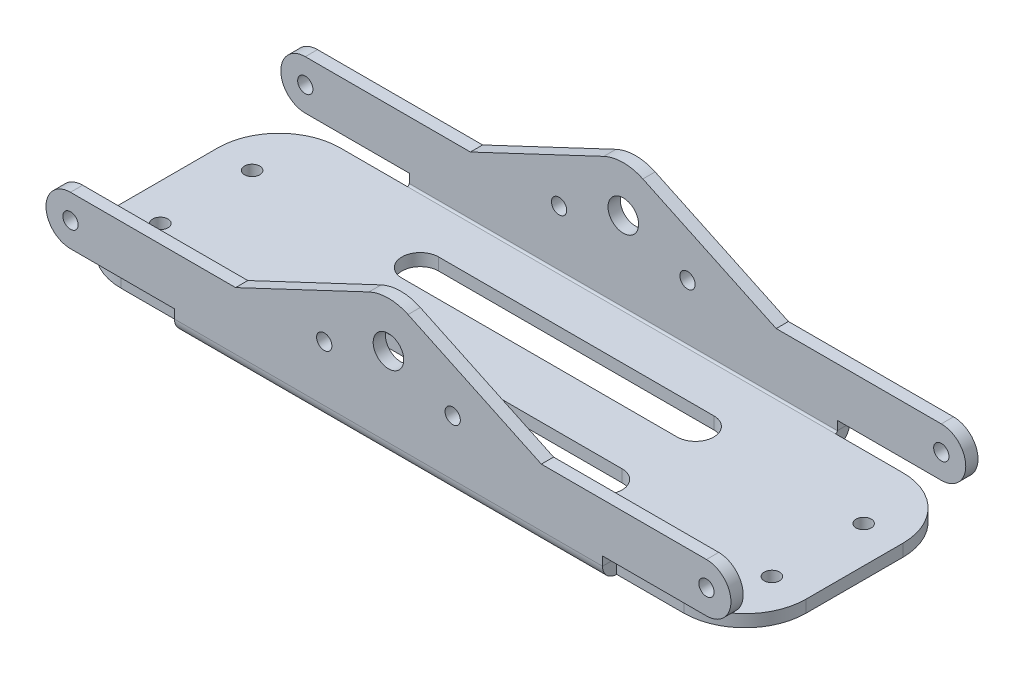
from build123d import *

# Parameters (mm, degrees)
BRIDA_BASE1_DEPTH               = 2
PLIEGUE_START                   = -56
PLIEGUE_CROQUIZADO2_DEPTH       = 112
PLIEGUE_CROQUIZADO2_2_OUTLINE_W = 19
PLIEGUE_CROQUIZADO2_2_OUTLINE_H = 2
PLIEGUE_CROQUIZADO2_2_DEPTH     = 112
PLIEGUE_START_2                 = -35
PLIEGUE_CROQUIZADO2_3_DEPTH     = 70
CROQUIS10_R                     = 1.25
CROQUIS10_R_2                   = 2.5
CORTAR_EXTRUIR2_DEPTH           = 73.104459651
CROQUIS11_R                     = 1.25
CORTAR_EXTRUIR3_DEPTH           = 10
REDONDEO1_R                     = 10


# Read off the part's stored shape, not the designer's step: Pliegue croquizado2
# Sheet-metal steps are written as plain solids
with BuildPart() as part:
    # Croquis base → Brida base1 (new body)
    with BuildSketch(Plane(origin=(0, 0, 0), x_dir=(1, 0, 0), z_dir=(0, 1, 0))):
        Polygon((56, 17.9), (56, -17.9), (35, -17.9), (35, -21.4), (56, -21.4), (56, -40.4), (-56, -40.4), (-56, -21.4), (-35, -21.4), (-35, -17.9), (-56, -17.9), (-56, 17.9), (-35, 17.9), (-35, 21.4), (-56, 21.4), (-56, 40.4), (56, 40.4), (56, 21.4), (35, 21.4), (35, 17.9), align=None)
    extrude(amount=-BRIDA_BASE1_DEPTH)

    # Pliegue croquizado2 outline → Pliegue croquizado2 (cut)
    with BuildSketch(Plane.YZ.offset(PLIEGUE_START)):
        with BuildLine():
            ThreePointArc((0, -20.18035085), (-1.429161647, -19.416575089), (-2, -17.9))
            Line((-2, -17.9), (-2, -40.4))
            Line((-2, -40.4), (0, -40.4))
            Line((0, -40.4), (0, -20.18035085))
        make_face()
        with BuildLine():
            ThreePointArc((-2, 17.9), (-1.429161647, 19.416575089), (0, 20.18035085))
            Line((0, 20.18035085), (0, 40.4))
            Line((0, 40.4), (-2, 40.4))
            Line((-2, 40.4), (-2, 17.9))
        make_face()
    extrude(amount=PLIEGUE_CROQUIZADO2_DEPTH, mode=Mode.SUBTRACT)



with BuildPart() as body_2:
    # Pliegue croquizado2 2 outline → Pliegue croquizado2 2 (new body)
    with BuildSketch(Plane.YZ.offset(PLIEGUE_START)):
        with Locations((11.257964775, -19.2)):
            Rectangle(PLIEGUE_CROQUIZADO2_2_OUTLINE_W, PLIEGUE_CROQUIZADO2_2_OUTLINE_H)
        with Locations((11.257964775, 19.2)):
            Rectangle(PLIEGUE_CROQUIZADO2_2_OUTLINE_W, PLIEGUE_CROQUIZADO2_2_OUTLINE_H)
    extrude(amount=PLIEGUE_CROQUIZADO2_2_DEPTH)


with BuildPart() as part_1:
    add(part.part)

    add(body_2.part)  # Pliegue croquizado2 3 merges body 2
    # Pliegue croquizado2 3 outline → Pliegue croquizado2 3 (add)
    with BuildSketch(Plane.YZ.offset(PLIEGUE_START_2)):
        with BuildLine():
            Line((0, -17.9), (0, -20.18035085))
            ThreePointArc((0, -20.18035085), (0.149678603, -20.195082456), (0.3, -20.2))
            Line((0.3, -20.2), (1.757964775, -20.2))
            Line((1.757964775, -20.2), (1.757964775, -18.2))
            Line((1.757964775, -18.2), (0.3, -18.2))
            ThreePointArc((0.3, -18.2), (0.087867966, -18.112132034), (0, -17.9))
        make_face()
        with BuildLine():
            ThreePointArc((0.3, 20.2), (0.149678603, 20.195082456), (0, 20.18035085))
            Line((0, 20.18035085), (0, 17.9))
            ThreePointArc((0, 17.9), (0.087867966, 18.112132034), (0.3, 18.2))
            Line((0.3, 18.2), (1.757964775, 18.2))
            Line((1.757964775, 18.2), (1.757964775, 20.2))
            Line((1.757964775, 20.2), (0.3, 20.2))
        make_face()
    extrude(amount=PLIEGUE_CROQUIZADO2_3_DEPTH)

    # Croquis10 → Cortar-Extruir2 (cut, through all)
    with BuildSketch(Plane.XY.offset(20.2)):
        with BuildLine():
            ThreePointArc((-56, 5.757964775), (-54.828427125, 8.5863919), (-52, 9.757964775))
            Line((-52, 9.757964775), (-25, 9.757964775))
            Line((-25, 9.757964775), (-3.19965236, 20.041195921))
            ThreePointArc((-3.19965236, 20.041195921), (-1.639476503, 20.576579179), (0, 20.757964775))
            Line((0, 20.757964775), (-56, 20.757964775))
            Line((-56, 20.757964775), (-56, 5.757964775))
        make_face()
        with BuildLine():
            ThreePointArc((-52, 1.757964775), (-54.828427125, 2.92953765), (-56, 5.757964775))
            Line((-56, 5.757964775), (-56, 1.757964775))
            Line((-56, 1.757964775), (-52, 1.757964775))
        make_face()
        with BuildLine():
            Line((56, 20.757964775), (0, 20.757964775))
            ThreePointArc((0, 20.757964775), (1.639476503, 20.576579179), (3.19965236, 20.041195921))
            Line((3.19965236, 20.041195921), (25, 9.757964775))
            Line((25, 9.757964775), (52, 9.757964775))
            ThreePointArc((52, 9.757964775), (54.828427125, 8.5863919), (56, 5.757964775))
            Line((56, 5.757964775), (56, 20.757964775))
        make_face()
        with BuildLine():
            Line((56, 1.757964775), (56, 5.757964775))
            ThreePointArc((56, 5.757964775), (54.828427125, 2.92953765), (52, 1.757964775))
            Line((52, 1.757964775), (56, 1.757964775))
        make_face()
        with Locations((52, 5.757964775)):
            Circle(CROQUIS10_R)
        with Locations((10.5, 9.357964775)):
            Circle(CROQUIS10_R)
        with Locations((-10.5, 9.357964775)):
            Circle(CROQUIS10_R)
        with Locations((0, 13.257964775)):
            Circle(CROQUIS10_R_2)
        with Locations((-52, 5.757964775)):
            Circle(CROQUIS10_R)
    extrude(amount=-CORTAR_EXTRUIR2_DEPTH, mode=Mode.SUBTRACT)

    # Croquis11 → Cortar-Extruir3 (cut)
    with BuildSketch(Plane(origin=(0, 0, 0), x_dir=(1, 0, 0), z_dir=(0, 1, 0))):
        with Locations(Location((-50, 7.5, 0), (0, 0, 270))):
            Circle(CROQUIS11_R)
        with Locations(Location((50, 7.5, 0), (0, 0, 270))):
            Circle(CROQUIS11_R)
        with Locations(Location((50, -7.5, 0), (0, 0, 90))):
            Circle(CROQUIS11_R)
        with Locations(Location((-50, -7.5, 0), (0, 0, 90))):
            Circle(CROQUIS11_R)
        with BuildLine():
            Line((-22.5, 10.5), (22.5, 10.5))
            ThreePointArc((22.5, 10.5), (25.5, 7.5), (22.5, 4.5))
            Line((22.5, 4.5), (-22.5, 4.5))
            ThreePointArc((-22.5, 4.5), (-25.5, 7.5), (-22.5, 10.5))
        make_face()
        with BuildLine():
            Line((-22.5, -10.5), (22.5, -10.5))
            ThreePointArc((22.5, -10.5), (25.5, -7.5), (22.5, -4.5))
            Line((22.5, -4.5), (-22.5, -4.5))
            ThreePointArc((-22.5, -4.5), (-25.5, -7.5), (-22.5, -10.5))
        make_face()
    extrude(amount=-CORTAR_EXTRUIR3_DEPTH, mode=Mode.SUBTRACT)

    # Redondeo1
    redondeo1_edges = [part_1.edges().sort_by_distance(p)[0] for p in [
        (-56, -1, 17.9),
        (-56, -1, -17.9),
        (56, -1, -17.9),
        (56, -1, 17.9),
    ]]
    fillet(redondeo1_edges, radius=REDONDEO1_R)


solid = part_1.part
